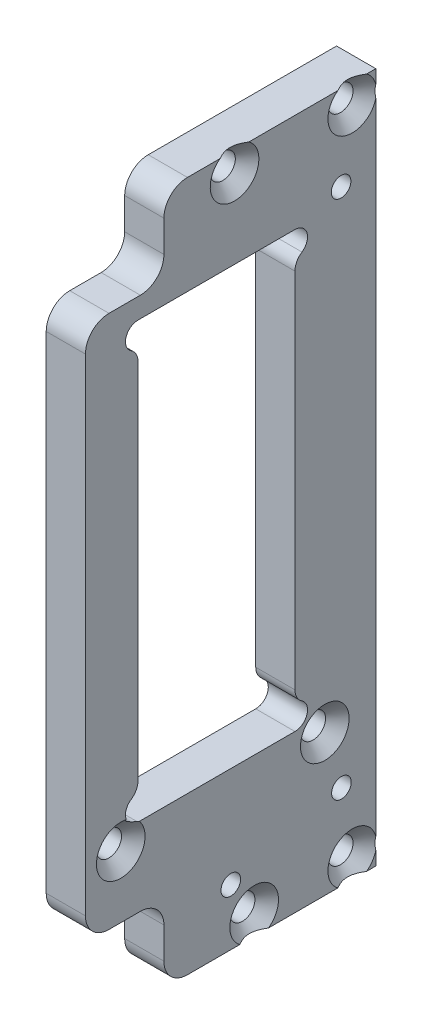
from build123d import *

# Parameters (mm, degrees)
SKETCH1_W           = 88
SKETCH1_H           = 37
SKETCH1_R           = 1.6
BOSS_EXTRUDE1_DEPTH = 5
FILLET1_R           = 5
CHAMFER2_SIZE       = 1.5
SKETCH2_R           = 1.25
CUT_EXTRUDE1_DEPTH  = 10
SKETCH3_W           = 10
SKETCH3_H           = 10
CUT_EXTRUDE2_DEPTH  = 10
FILLET2_R           = 3


with BuildPart() as part:
    # Sketch1 → Boss-Extrude1 (new body)
    with BuildSketch(Plane.YZ):
        Rectangle(SKETCH1_W, SKETCH1_H)
        with Locations(Location((-41.5, -15.5, 0), (0, 0, 270))):
            Circle(SKETCH1_R, mode=Mode.SUBTRACT)
        with Locations(Location((-41.5, -3, 0), (0, 0, 270))):
            Circle(SKETCH1_R, mode=Mode.SUBTRACT)
        with Locations(Location((41.5, -15.5, 0), (0, 0, 90))):
            Circle(SKETCH1_R, mode=Mode.SUBTRACT)
        with Locations(Location((-26, 14, 0), (0, 0, 270))):
            Circle(SKETCH1_R, mode=Mode.SUBTRACT)
        with Locations(Location((-26, -12, 0), (0, 0, 270))):
            Circle(SKETCH1_R, mode=Mode.SUBTRACT)
        with Locations(Location((41.5, -0.5, 0), (0, 0, 270))):
            Circle(SKETCH1_R, mode=Mode.SUBTRACT)
        with BuildLine():
            Line((-24, -8.2), (-24, 11.8))
            ThreePointArc((-24, 11.8), (-22.86444197, 13.331108636), (-21.069632929, 12.688888889))
            ThreePointArc((-21.069632929, 12.688888889), (-20.349483132, 12.036165793), (-19.406674091, 11.8))
            Line((-19.406674091, 11.8), (26.806674091, 11.8))
            ThreePointArc((26.806674091, 11.8), (27.749483132, 12.036165793), (28.469632929, 12.688888889))
            ThreePointArc((28.469632929, 12.688888889), (30.26444197, 13.331108636), (31.4, 11.8))
            Line((31.4, 11.8), (31.4, -8.2))
            ThreePointArc((31.4, -8.2), (30.26444197, -9.731108636), (28.469632929, -9.088888889))
            ThreePointArc((28.469632929, -9.088888889), (27.749483132, -8.436165793), (26.806674091, -8.2))
            Line((26.806674091, -8.2), (-19.406674091, -8.2))
            ThreePointArc((-19.406674091, -8.2), (-20.349483132, -8.436165793), (-21.069632929, -9.088888889))
            ThreePointArc((-21.069632929, -9.088888889), (-22.86444197, -9.731108636), (-24, -8.2))
        make_face(mode=Mode.SUBTRACT)
    extrude(amount=BOSS_EXTRUDE1_DEPTH)

    # Fillet1
    fillet1_edges = [part.edges().sort_by_distance(p)[0] for p in [
        (2.5, -44, 18.5),
        (2.5, 44, 18.5),
    ]]
    fillet(fillet1_edges, radius=FILLET1_R)

    # Chamfer2
    # the kernel refuses this chamfer: 1.5 mm, written as the material it takes off along each edge
    with BuildSketch(Plane(origin=(5, -41.5, -15.5), x_dir=(0, 0, -1), z_dir=(0, -1, 0))) as chamfer2_piece_1:
        Polygon((1.6 + CHAMFER2_SIZE, 0), (1.6, -CHAMFER2_SIZE), (1.6, 0), align=None)
    revolve(axis=Axis((5, -41.5, -15.5), (1, 0, 0)), mode=Mode.SUBTRACT)
    with BuildSketch(Plane(origin=(5, -41.5, -3), x_dir=(0, 0, -1), z_dir=(0, -1, 0))) as chamfer2_piece_2:
        Polygon((1.6 + CHAMFER2_SIZE, 0), (1.6, -CHAMFER2_SIZE), (1.6, 0), align=None)
    revolve(axis=Axis((5, -41.5, -3), (1, 0, 0)), mode=Mode.SUBTRACT)
    with BuildSketch(Plane(origin=(5, 41.5, -0.5), x_dir=(0, 0, -1), z_dir=(0, -1, 0))) as chamfer2_piece_3:
        Polygon((1.6 + CHAMFER2_SIZE, 0), (1.6, -CHAMFER2_SIZE), (1.6, 0), align=None)
    revolve(axis=Axis((5, 41.5, -0.5), (1, 0, 0)), mode=Mode.SUBTRACT)
    with BuildSketch(Plane(origin=(5, 41.5, -15.5), x_dir=(0, 0, 1), z_dir=(0, 1, 0))) as chamfer2_piece_4:
        Polygon((1.6 + CHAMFER2_SIZE, 0), (1.6, -CHAMFER2_SIZE), (1.6, 0), align=None)
    revolve(axis=Axis((5, 41.5, -15.5), (1, 0, 0)), mode=Mode.SUBTRACT)
    with BuildSketch(Plane(origin=(5, -26, 14), x_dir=(0, 0, -1), z_dir=(0, -1, 0))) as chamfer2_piece_5:
        Polygon((1.6 + CHAMFER2_SIZE, 0), (1.6, -CHAMFER2_SIZE), (1.6, 0), align=None)
    revolve(axis=Axis((5, -26, 14), (1, 0, 0)), mode=Mode.SUBTRACT)
    with BuildSketch(Plane(origin=(5, -26, -12), x_dir=(0, 0, -1), z_dir=(0, -1, 0))) as chamfer2_piece_6:
        Polygon((1.6 + CHAMFER2_SIZE, 0), (1.6, -CHAMFER2_SIZE), (1.6, 0), align=None)
    revolve(axis=Axis((5, -26, -12), (1, 0, 0)), mode=Mode.SUBTRACT)

    # Sketch2 → Cut-Extrude1 (cut)
    with BuildSketch(Plane.YZ.offset(5)):
        with Locations(Location((-36.826603685, -0.023130638, 0), (0, 0, 270))):
            Circle(SKETCH2_R)
        with Locations(Location((-33.167413509, -14.120748425, 0), (0, 0, 270))):
            Circle(SKETCH2_R)
        with Locations(Location((33.182572395, -14.077498807, 0), (0, 0, 270))):
            Circle(SKETCH2_R)
    extrude(amount=-CUT_EXTRUDE1_DEPTH, mode=Mode.SUBTRACT)

    # Sketch3 → Cut-Extrude2 (cut)
    with BuildSketch(Plane.YZ.offset(5)):
        with Locations((-39, 13.5)):
            Rectangle(SKETCH3_W, SKETCH3_H)
        with Locations((39, 13.5)):
            Rectangle(SKETCH3_W, SKETCH3_H)
    extrude(amount=-CUT_EXTRUDE2_DEPTH, mode=Mode.SUBTRACT)

    # Fillet2
    fillet2_edges = [part.edges().sort_by_distance(p)[0] for p in [
        (2.5, -34, 18.5),
        (2.5, -34, 8.5),
        (2.5, -44, 8.5),
        (2.5, 44, 8.5),
        (2.5, 34, 8.5),
        (2.5, 34, 18.5),
    ]]
    fillet(fillet2_edges, radius=FILLET2_R)


solid = part.part
